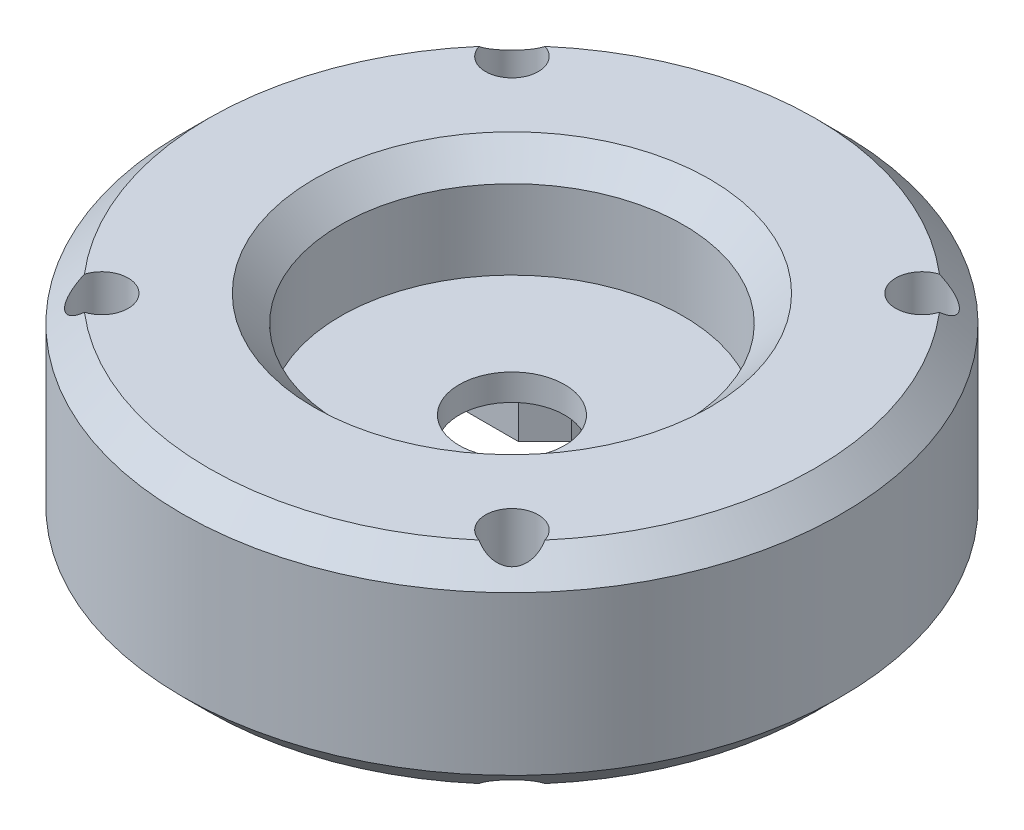
from build123d import *

# Parameters (mm, degrees)
SKETCH1_R           = 12.5
BOSS_EXTRUDE1_DEPTH = 8
SKETCH2_R           = 6.5
CUT_EXTRUDE1_DEPTH  = 4
SKETCH4_R           = 2
CUT_EXTRUDE3_DEPTH  = 4
SKETCH5_W           = 4
SKETCH5_H           = 6
CUT_EXTRUDE4_DEPTH  = 3
SKETCH3_R           = 1
CUT_EXTRUDE2_DEPTH  = 20.403607912
CHAMFER1_SIZE       = 1
CHAMFER2_SIZE       = 1


with BuildPart() as part:
    # Sketch1 → Boss-Extrude1 (new body)
    with BuildSketch(Plane(origin=(0, 0, 0), x_dir=(1, 0, 0), z_dir=(0, 1, 0))):
        with Locations(Location((0, 0, 0), (0, 0, 270))):
            Circle(SKETCH1_R)
    extrude(amount=BOSS_EXTRUDE1_DEPTH)

    # Sketch2 → Cut-Extrude1 (cut)
    with BuildSketch(Plane(origin=(0, 8, 0), x_dir=(1, 0, 0), z_dir=(0, 1, 0))):
        with Locations(Location((0, 0, 0), (0, 0, 270))):
            Circle(SKETCH2_R)
    extrude(amount=-CUT_EXTRUDE1_DEPTH, mode=Mode.SUBTRACT)

    # Sketch4 → Cut-Extrude3 (cut)
    with BuildSketch(Plane(origin=(0, 0, 0), x_dir=(-1, 0, 0), z_dir=(0, -1, 0))):
        with Locations(Location((0, 0, 0), (0, 0, 90))):
            Circle(SKETCH4_R)
    extrude(amount=-CUT_EXTRUDE3_DEPTH, mode=Mode.SUBTRACT)

    # Sketch5 → Cut-Extrude4 (cut)
    with BuildSketch(Plane(origin=(0, 0, 0), x_dir=(-1, 0, 0), z_dir=(0, -1, 0))):
        with Locations((0, -6.25)):
            Rectangle(SKETCH5_W, SKETCH5_H)
        Polygon((-10, -3.25), (-2, -3.25), (-2, 4e-09), (-2, 3.25), (-10, 3.25), align=None)
        with BuildLine():
            Line((-2, -3.25), (2, -3.25))
            Line((2, -3.25), (2, 0))
            ThreePointArc((2, 0), (-2e-09, -2), (-2, 4e-09))
            Line((-2, 4e-09), (-2, -3.25))
        make_face()
        with Locations((0, 6.25)):
            Rectangle(SKETCH5_W, SKETCH5_H)
        Polygon((2, -3.25), (10, -3.25), (10, 3.25), (2, 3.25), (2, 0), align=None)
        with BuildLine():
            ThreePointArc((-2, 4e-09), (2e-09, 2), (2, 0))
            Line((2, 0), (2, 3.25))
            Line((2, 3.25), (-2, 3.25))
            Line((-2, 3.25), (-2, 4e-09))
        make_face()
    extrude(amount=-CUT_EXTRUDE4_DEPTH, mode=Mode.SUBTRACT)

    # Sketch3 → Cut-Extrude2 (cut, through all)
    with BuildSketch(Plane(origin=(0, 8, 0), x_dir=(1, 0, 0), z_dir=(0, 1, 0))):
        with Locations(Location((7.778174593, 7.778174593, 0), (0, 0, 270))):
            Circle(SKETCH3_R)
        with Locations(Location((7.778174593, -7.778174593, 0), (0, 0, 270))):
            Circle(SKETCH3_R)
        with Locations(Location((-7.778174593, -7.778174593, 0), (0, 0, 270))):
            Circle(SKETCH3_R)
        with Locations(Location((-7.778174593, 7.778174593, 0), (0, 0, 270))):
            Circle(SKETCH3_R)
    extrude(amount=-CUT_EXTRUDE2_DEPTH, mode=Mode.SUBTRACT)

    # Chamfer1
    # the kernel refuses this chamfer: 1 mm, written as the material it takes off along each edge
    with BuildSketch(Plane(origin=(0, 0, 0), x_dir=(0, 0, 1), z_dir=(-1, 0, 0))) as chamfer1_piece_1:
        Polygon((12.5, CHAMFER1_SIZE), (12.5 - CHAMFER1_SIZE, 0), (12.5, 0), align=None)
    revolve(axis=Axis((0, 0, 0), (0, 1, 0)), mode=Mode.SUBTRACT)
    with BuildSketch(Plane(origin=(0, 8, 0), x_dir=(0, 0, 1), z_dir=(-1, 0, 0))) as chamfer1_piece_2:
        Polygon((12.5, -CHAMFER1_SIZE), (12.5 - CHAMFER1_SIZE, 0), (12.5, 0), align=None)
    revolve(axis=Axis((0, 8, 0), (0, 1, 0)), mode=Mode.SUBTRACT)
    with BuildSketch(Plane(origin=(0, 8, 0), x_dir=(0, 0, 1), z_dir=(-1, 0, 0))) as chamfer1_piece_3:
        Polygon((6.5 + CHAMFER1_SIZE, 0), (6.5, -CHAMFER1_SIZE), (6.5, 0), align=None)
    revolve(axis=Axis((0, 8, 0), (0, 1, 0)), mode=Mode.SUBTRACT)

    # Chamfer2
    chamfer2_edges = [part.edges().sort_by_distance(p)[0] for p in [
        (2, 1.5, -3.25),
        (-2, 1.5, -3.25),
        (-2, 1.5, 3.25),
        (2, 1.5, 3.25),
    ]]
    chamfer(chamfer2_edges, length=CHAMFER2_SIZE)


solid = part.part
